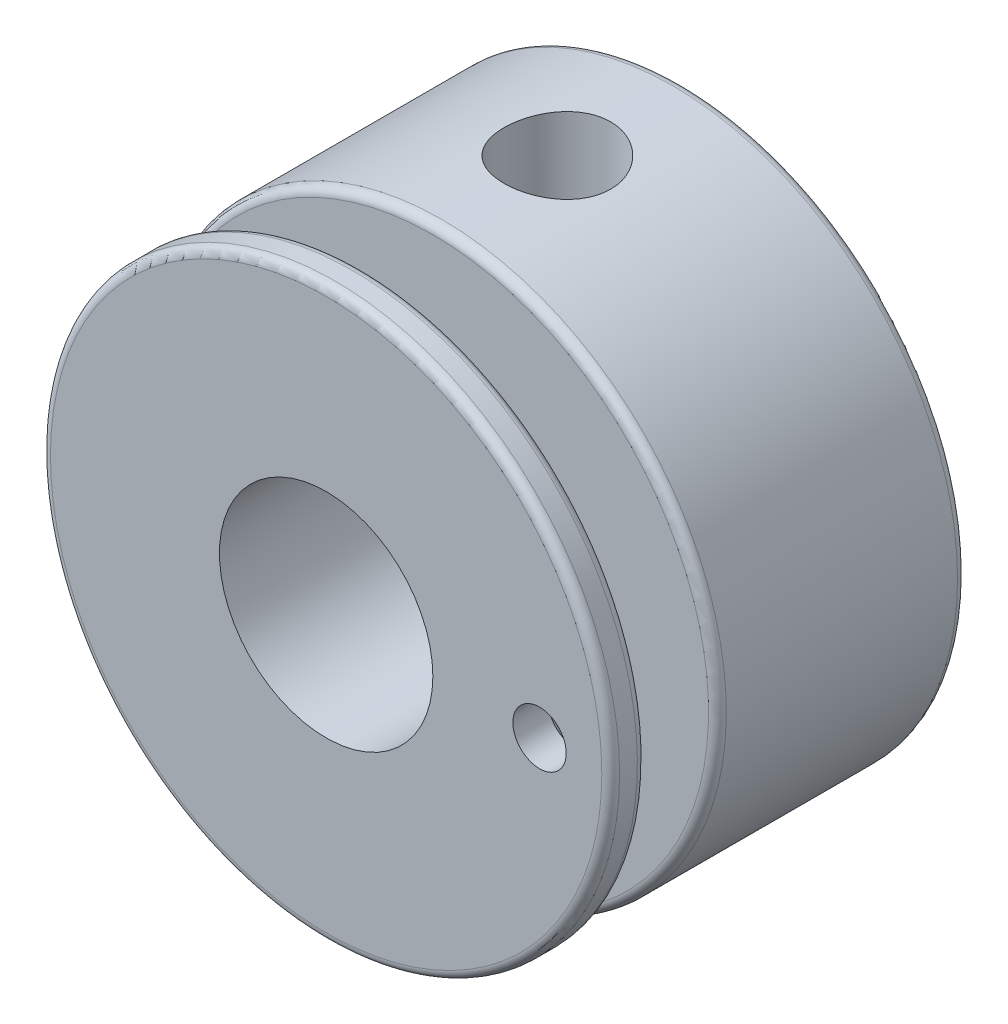
from build123d import *

# Parameters (mm, degrees)
SKETCH1_R           = 8
BOSS_EXTRUDE1_DEPTH = 10
SKETCH2_W           = 2
SKETCH2_H           = 3
CUT_EXTRUDE1_REACH  = 19.6
CUT_EXTRUDE1_START  = 2.5
SKETCH5_R           = 1.5
CUT_EXTRUDE2_REACH  = 17.1
SKETCH6_R           = 3
FILLET3_R           = 0.25
FILLET4_R           = 0.25
FILLET5_R           = 0.25
CUT_EXTRUDE3_REACH  = 17.1
SKETCH7_R           = 0.75


with BuildPart() as part:
    # Sketch1 → Boss-Extrude1 (new body)
    with BuildSketch(Plane.XY):
        Circle(SKETCH1_R)
    extrude(amount=BOSS_EXTRUDE1_DEPTH)

    # Sketch2 → Cut-Revolve2 (revolve, cut)
    with BuildSketch(Plane(origin=(0, 0, 0), x_dir=(0, 0, -1), z_dir=(1, 0, 0))):
        with Locations((-8, 6.5)):
            Rectangle(SKETCH2_W, SKETCH2_H)
    revolve(axis=Axis((0, 0, -5.249485175), (0, 0, 1)), mode=Mode.SUBTRACT)

    # Sketch5 → Cut-Extrude1 (cut, up to next)
    with BuildSketch(Plane(origin=(0, 0, 0), x_dir=(1, 0, 0), z_dir=(0, 1, 0)).offset(CUT_EXTRUDE1_START), mode=Mode.PRIVATE) as cut_extrude1_sk1:
        with Locations((0, -3.5)):
            Circle(SKETCH5_R)
    cut_extrude1_tool1 = extrude(cut_extrude1_sk1.sketch, amount=CUT_EXTRUDE1_REACH, mode=Mode.PRIVATE) & part.part
    add(cut_extrude1_tool1.solids().sort_by_distance((0, 2.5, 3.5))[0], mode=Mode.SUBTRACT)

    # Sketch6 → Cut-Extrude2 (cut, up to next)
    with BuildSketch(Plane.XY, mode=Mode.PRIVATE) as cut_extrude2_sk1:
        Circle(SKETCH6_R)
    cut_extrude2_tool1 = extrude(cut_extrude2_sk1.sketch, amount=CUT_EXTRUDE2_REACH, mode=Mode.PRIVATE) & part.part
    add(cut_extrude2_tool1.solids().sort_by_distance((0, 0, 0))[0], mode=Mode.SUBTRACT)

    # Fillet3
    fillet3_edges = [part.edges().sort_by_distance(p)[0] for p in [
        (-8, 0, 9),
    ]]
    fillet(fillet3_edges, radius=FILLET3_R)

    # Fillet4
    fillet4_edges = [part.edges().sort_by_distance(p)[0] for p in [
        (-8, 0, 7),
    ]]
    fillet(fillet4_edges, radius=FILLET4_R)

    # Fillet5
    fillet5_edges = [part.edges().sort_by_distance(p)[0] for p in [
        (-8, 0, 0),
        (-8, 0, 10),
    ]]
    fillet(fillet5_edges, radius=FILLET5_R)

    # Sketch7 → Cut-Extrude3 (cut, up to next)
    with BuildSketch(Plane.XY.offset(10), mode=Mode.PRIVATE) as cut_extrude3_sk1:
        with Locations((6, 0)):
            Circle(SKETCH7_R)
    cut_extrude3_tool1 = extrude(cut_extrude3_sk1.sketch, amount=-CUT_EXTRUDE3_REACH, mode=Mode.PRIVATE) & part.part
    add(cut_extrude3_tool1.solids().sort_by_distance((6, 0, 10))[0], mode=Mode.SUBTRACT)


solid = part.part
